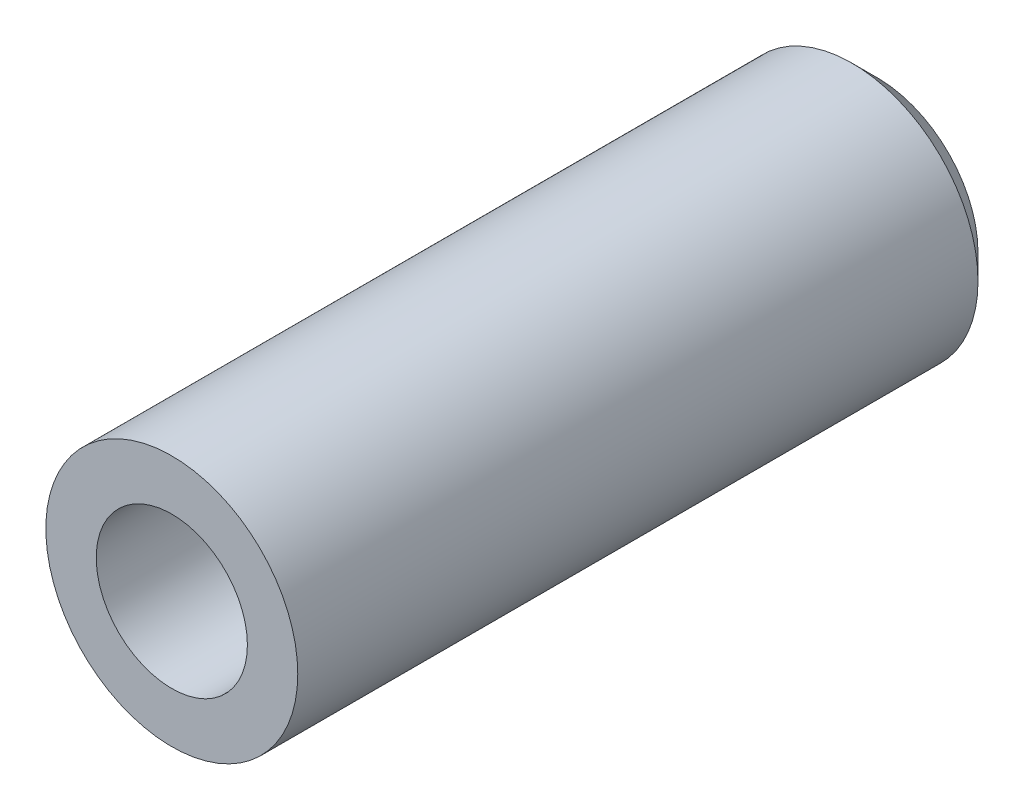
from build123d import *

# Parameters (mm, degrees)
ESQUISSE1_R             = 5
BOSS_EXTRU_1_DEPTH      = 28
ESQUISSE2_R             = 3
ENL_V_MAT_EXTRU_1_DEPTH = 13
ESQUISSE3_R             = 1
ENL_V_MAT_EXTRU_2_DEPTH = 308.835027536
CHANFREIN1_SIZE         = 1


with BuildPart() as part:
    # Esquisse1 → Boss.-Extru.1 (new body)
    with BuildSketch(Plane.XY):
        with Locations((38.379614242, 299.393845612)):
            Circle(ESQUISSE1_R)
    extrude(amount=BOSS_EXTRU_1_DEPTH)

    # Esquisse2 → Enlèv. mat.-Extru.1 (cut)
    with BuildSketch(Plane.XY.offset(28)):
        with Locations((38.379614242, 299.393845612)):
            Circle(ESQUISSE2_R)
    extrude(amount=-ENL_V_MAT_EXTRU_1_DEPTH, mode=Mode.SUBTRACT)

    # Esquisse3 → Enlèv. mat.-Extru.2 (cut, through all)
    with BuildSketch(Plane.XY.offset(15)):
        with Locations((38.379614242, 299.393845612)):
            Circle(ESQUISSE3_R)
    extrude(amount=-ENL_V_MAT_EXTRU_2_DEPTH, mode=Mode.SUBTRACT)

    # Chanfrein1
    chanfrein1_edges = [part.edges().sort_by_distance(p)[0] for p in [
        (33.379614242, 299.393845612, 0),
    ]]
    chamfer(chanfrein1_edges, length=CHANFREIN1_SIZE)


solid = part.part
